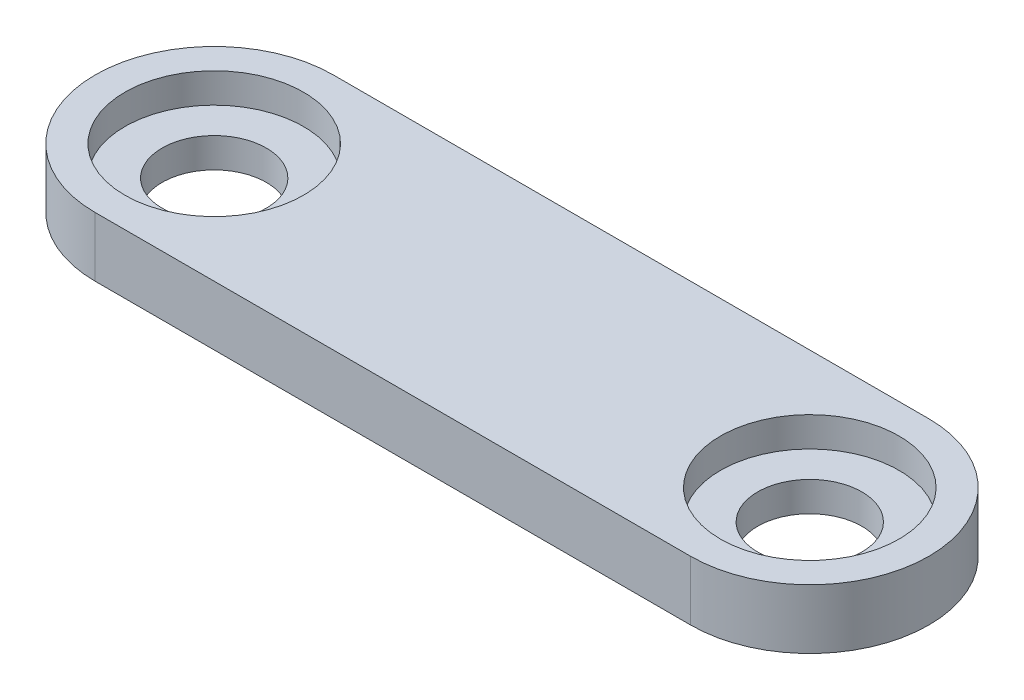
from build123d import *

# Parameters (mm, degrees)
SKETCH1_R           = 1.75
BOSS_EXTRUDE1_DEPTH = 2
SKETCH3_R           = 3
CUT_EXTRUDE1_DEPTH  = 1


with BuildPart() as part:
    # Sketch1 → Boss-Extrude1 (new body)
    with BuildSketch(Plane(origin=(0, 0, 0), x_dir=(1, 0, 0), z_dir=(0, 1, 0))):
        with BuildLine():
            Line((-10, 4), (10, 4))
            ThreePointArc((10, 4), (14, 0), (10, -4))
            Line((10, -4), (-10, -4))
            ThreePointArc((-10, -4), (-14, 0), (-10, 4))
        make_face()
        with Locations((-10, 0)):
            Circle(SKETCH1_R, mode=Mode.SUBTRACT)
        with Locations((10, 0)):
            Circle(SKETCH1_R, mode=Mode.SUBTRACT)
    extrude(amount=BOSS_EXTRUDE1_DEPTH)

    # Sketch3 → Cut-Extrude1 (cut)
    with BuildSketch(Plane(origin=(0, 2, 0), x_dir=(1, 0, 0), z_dir=(0, 1, 0))):
        with Locations((-10, 0)):
            Circle(SKETCH3_R)
        with Locations((10, 0)):
            Circle(SKETCH3_R)
    extrude(amount=-CUT_EXTRUDE1_DEPTH, mode=Mode.SUBTRACT)


solid = part.part
